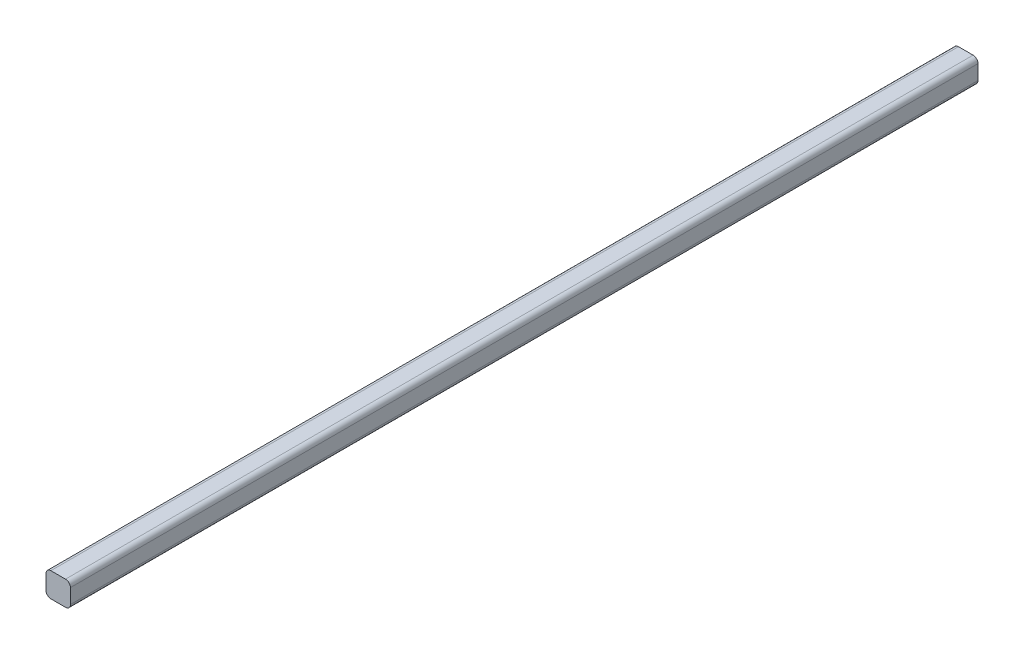
from build123d import *

# Parameters (mm, degrees)
ESQUISSE1_W        = 50
ESQUISSE1_H        = 50
BOSS_EXTRU_1_DEPTH = 1860
CONG_1_R           = 10


with BuildPart() as part:
    # Esquisse1 → Boss.-Extru.1 (new body)
    with BuildSketch(Plane.XY):
        with Locations((25, 25)):
            Rectangle(ESQUISSE1_W, ESQUISSE1_H)
    extrude(amount=BOSS_EXTRU_1_DEPTH)

    # Congé1
    cong_1_edges = [part.edges().sort_by_distance(p)[0] for p in [
        (0, 0, 930),
        (50, 0, 930),
        (0, 50, 930),
        (50, 50, 930),
    ]]
    fillet(cong_1_edges, radius=CONG_1_R)


solid = part.part
